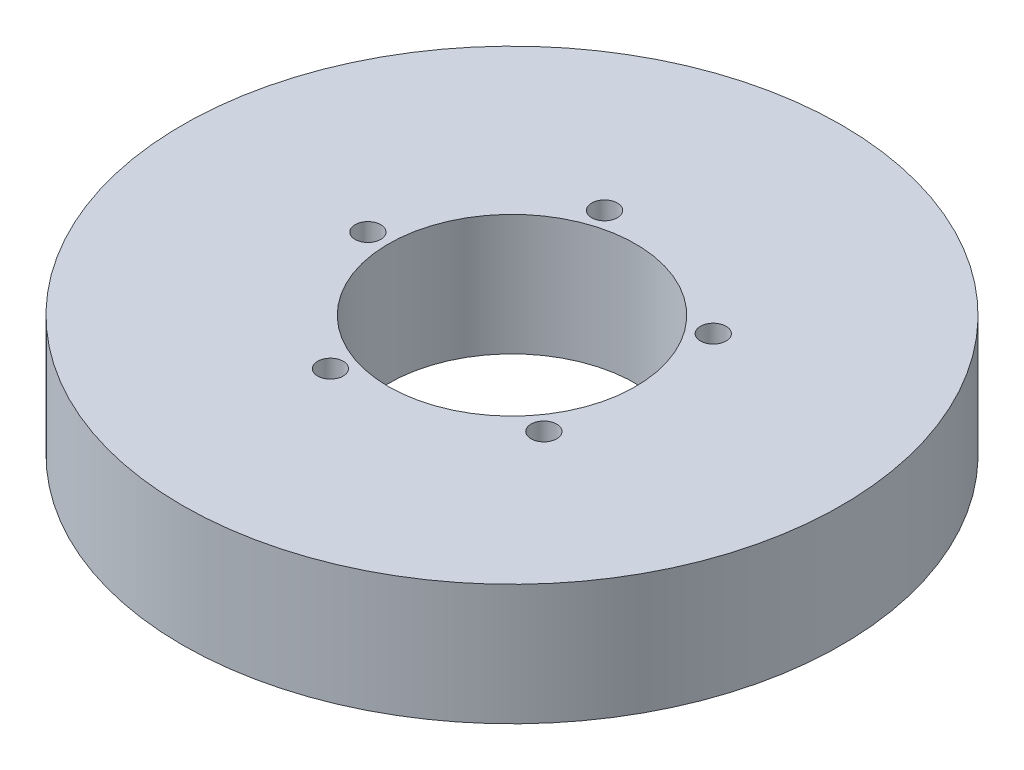
from build123d import *

# Parameters (mm, degrees)
SKETCH1_R           = 60
BOSS_EXTRUDE1_DEPTH = 22
SKETCH2_R           = 22.5
CUT_EXTRUDE1_DEPTH  = 88.658428003
SKETCH3_R           = 2.336083274
CUT_EXTRUDE2_DEPTH  = 20.04160133
CIRPATTERN1_COUNT   = 5


with BuildPart() as part:
    # Sketch1 → Boss-Extrude1 (new body)
    with BuildSketch(Plane(origin=(0, 0, 0), x_dir=(1, 0, 0), z_dir=(0, 1, 0))):
        Circle(SKETCH1_R)
    extrude(amount=BOSS_EXTRUDE1_DEPTH)

    # Sketch2 → Cut-Extrude1 (cut, through all)
    with BuildSketch(Plane(origin=(0, 0, 0), x_dir=(1, 0, 0), z_dir=(0, 1, 0))):
        Circle(SKETCH2_R)
    extrude(amount=CUT_EXTRUDE1_DEPTH, mode=Mode.SUBTRACT)

    # Sketch3 → Cut-Extrude2 (cut)
    with BuildSketch(Plane(origin=(0, 22, 0), x_dir=(1, 0, 0), z_dir=(0, 1, 0))):
        with Locations((-26.234340362, 0)):
            Circle(SKETCH3_R)
    cut_extrude2 = extrude(amount=-CUT_EXTRUDE2_DEPTH, mode=Mode.SUBTRACT)

    # CirPattern1: Cut-Extrude2 ×5 about axis
    cirpattern1_axis = Axis((0, 0, 0), (0, 1, 0))
    for i in range(1, CIRPATTERN1_COUNT):
        add(cut_extrude2.rotate(cirpattern1_axis, i * 360 / CIRPATTERN1_COUNT), mode=Mode.SUBTRACT)


solid = part.part
